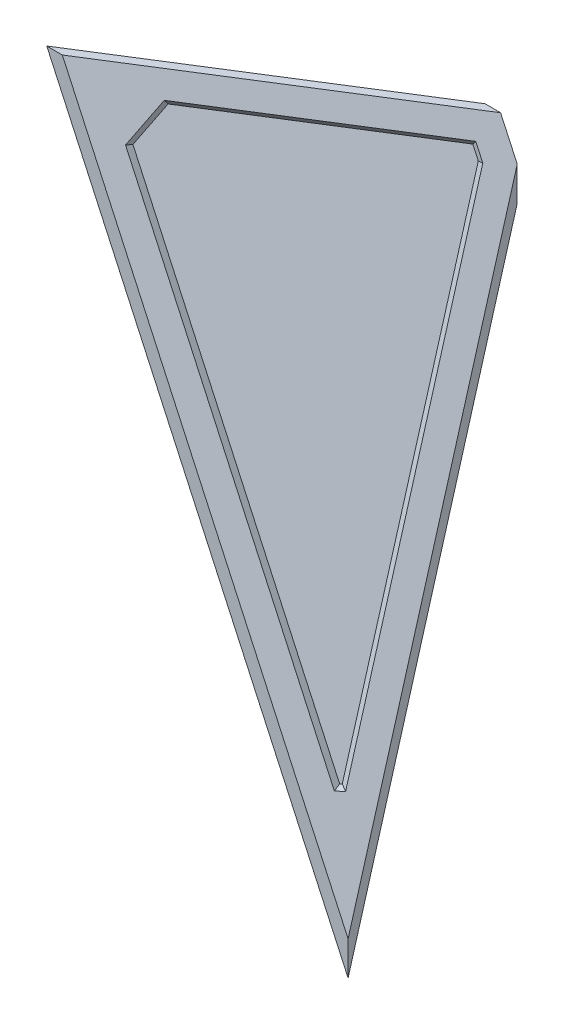
from build123d import *

# Parameters (mm, degrees)
BOSS_EXTRU_1_DEPTH      = 210
ENL_V_MAT_EXTRU_4_DEPTH = 922.018231875
ENL_V_MAT_EXTRU_5_DEPTH = 922.018231875
ENL_V_MAT_EXTRU_6_DEPTH = 923.94578116
ENL_V_MAT_EXTRU_7_DEPTH = 5
CHANFREIN1_SIZE         = 5


with BuildPart() as part:
    # Esquisse1 → Boss.-Extru.1 (new body)
    with BuildSketch(Plane.XY):
        Polygon((0, 0), (0, 815), (-374.098360656, 815), align=None)
    extrude(amount=-BOSS_EXTRU_1_DEPTH)

    # Esquisse4 → Enlèv. mat.-Extru.4 (cut, through all)
    with BuildSketch(Plane(origin=(0, 815, 0), x_dir=(1, 0, 0), z_dir=(0, 1, 0))):
        Polygon((-40, 210), (-374.098360656, 0), (-374.098360656, 210), align=None)
    extrude(amount=-ENL_V_MAT_EXTRU_4_DEPTH, mode=Mode.SUBTRACT)

    # Esquisse5 → Enlèv. mat.-Extru.5 (cut, through all)
    with BuildSketch(Plane(origin=(0, 0, 0), x_dir=(-0.8560075896570557, 0.14330783348955523, 0.49670300110835625), z_dir=(-0.5169632544480486, -0.23729460859910434, -0.8224598849064191))):
        Polygon((437.026920294, 783.059419447), (0, 0), (-104.307630233, 58.214282686), (12.488254061, 841.273702133), (46.728557648, 841.273702133), align=None)
    extrude(amount=ENL_V_MAT_EXTRU_5_DEPTH, mode=Mode.SUBTRACT)

    # Esquisse6 → Enlèv. mat.-Extru.6 (cut, through all)
    with BuildSketch(Plane(origin=(5.169632544, 2.372946086, 8.224598849), x_dir=(-0.8560075896570557, 0.14330783348955523, 0.49670300110835625), z_dir=(-0.5169632544480486, -0.23729460859910434, -0.8224598849064191))):
        Polygon((437.026920294, 783.059419447), (46.728557648, 841.273702133), (12.488254061, 841.273702133), (0, 757.546051675), (0, 0), align=None)
    extrude(amount=-ENL_V_MAT_EXTRU_6_DEPTH, mode=Mode.SUBTRACT)

    # Esquisse7 → Enlèv. mat.-Extru.7 (cut)
    with BuildSketch(Plane(origin=(5.169632544, 2.372946086, 8.224598849), x_dir=(0.8560075896570555, -0.14330783348955536, -0.4967030011083565), z_dir=(0.5169632544480489, 0.23729460859910445, 0.8224598849064189))):
        Polygon((-45.786058342, 173.266527892), (-36.039236809, 175.802293869), (-36.039236809, 790.231286712), (-46.25858999, 808.542197087), (-323.672371858, 767.165020382), (-348.758261389, 716.128366398), align=None)
    extrude(amount=-ENL_V_MAT_EXTRU_7_DEPTH, mode=Mode.SUBTRACT)

    # Chanfrein1
    chanfrein1_edges = [part.edges().sort_by_distance(p)[0] for p in [
        (-32.436720565, 174.743826797, -23.949101615),
        (-166.281649801, 456.726474452, -21.176992916),
        (-285.218046516, 761.94965633, -34.481068848),
        (-155.747039223, 784.670394973, -122.416375357),
        (-32.638965904, 775.141493599, -197.047605933),
        (-28.265043962, 470.438107301, -111.884408124),
    ]]
    chamfer(chanfrein1_edges, length=CHANFREIN1_SIZE - 0.0001)  # a hair under: the kernel refuses the full size


solid = part.part
